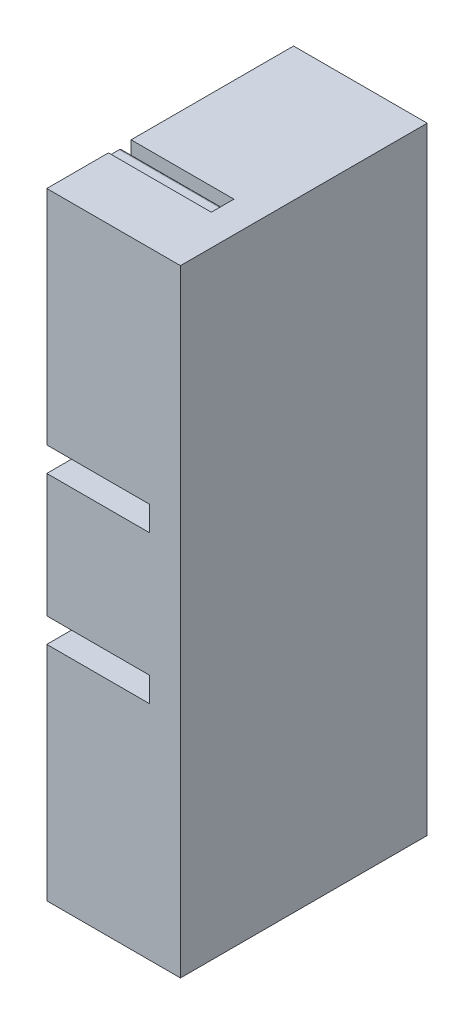
from build123d import *

# Parameters (mm, degrees)
SKETCH_1_W           = 150
SKETCH_1_H           = 140
EXTRUDE_1_DEPTH      = 3
EXTRUDE_2_DEPTH      = 14
EXTRUDE_2_DEPTH_BACK = 14
EXTRUDE_START        = 38
EXTRUDE_3_DEPTH      = 14
EXTRUDE_START_2      = 50.2
EXTRUDE_5_DEPTH      = 1.8
EXTRUDE_START_3      = 24
EXTRUDE_6_DEPTH      = 1.8
EXTRUDE_START_4      = 12.2
EXTRUDE_7_DEPTH      = 1.8
EXTRUDE_START_5      = -14
EXTRUDE_8_DEPTH      = 1.8
EXTRUDE_START_6      = -52
EXTRUDE_9_DEPTH      = 1.8
EXTRUDE_START_7      = -25.8
EXTRUDE_10_DEPTH     = 1.8
FILLET_1_R           = 1
CUT_EXTRUDE_5_REACH  = 105.412
SKETCH_5_W           = 1
SKETCH_5_H           = 4.5
CUT_EXTRUDE_6_REACH  = 105.078
SKETCH_3_9_R         = 1.7
CUT_EXTRUDE_7_DEPTH  = 10
EXTRUDE_START_8      = 3
SKETCH_3_12_W        = 10.254153824
SKETCH_3_12_H        = 16
EXTRUDE_11_DEPTH     = 3
CUT_EXTRUDE_START    = -15
SKETCH_6_W           = 2
SKETCH_6_H           = 4.5
CUT_EXTRUDE_8_DEPTH  = 20
CUT_EXTRUDE_START_2  = -115
SKETCH_6_3_W         = 2
SKETCH_6_3_H         = 4.5
CUT_EXTRUDE_9_DEPTH  = 20
CHAMFER_2_SIZE       = 2
FILLET_2_R           = 4
EXTRUDE_12_DEPTH     = 24
CUT_EXTRUDE_10_DEPTH = 10
SKETCH_8_W           = 8.2
SKETCH_8_H           = 2.4
CUT_EXTRUDE_11_DEPTH = 10
CHAMFER_1_SIZE       = 5
CHAMFER_1_SIZE2      = 10.2
CHAMFER_3_SIZE       = 5
CHAMFER_3_SIZE2      = 10.2
CUT_EXTRUDE_13_DEPTH = 132.034346642
SKETCH_10_R          = 1.7
EXTRUDE_13_DEPTH     = 3
EXTRUDE_14_DEPTH     = 3


with BuildPart() as part:
    # 草图1 → 凸台-拉伸1 (new body)
    with BuildSketch(Plane.XY):
        Rectangle(SKETCH_1_W, SKETCH_1_H)
    extrude(amount=EXTRUDE_1_DEPTH)

    # 草图2 → 凸台-拉伸2 (add, two sides: drawn at the far end of the back side and taken through both)
    with BuildSketch(Plane(origin=(0, 0, 0), x_dir=(1, 0, 0), z_dir=(0, 1, 0)).offset(-EXTRUDE_2_DEPTH_BACK)):
        with BuildLine():
            Line((56, -5), (56, -3))
            Line((56, -3), (44, -3))
            Line((44, -3), (44, -5))
            ThreePointArc((44, -5), (41.05572809, -8.527864045), (40, -13))
            Line((40, -13), (42.5, -13))
            ThreePointArc((42.5, -13), (50, -5.5), (57.5, -13))
            Line((57.5, -13), (60, -13))
            ThreePointArc((60, -13), (58.94427191, -8.527864045), (56, -5))
        make_face()
    extrude(amount=EXTRUDE_2_DEPTH + EXTRUDE_2_DEPTH_BACK)

    # 草图2<3> → 凸台-拉伸3 (add, symmetric)
    with BuildSketch(Plane(origin=(0, 0, 0), x_dir=(1, 0, 0), z_dir=(0, 1, 0)).offset(EXTRUDE_START)):
        with BuildLine():
            Line((-60, -13), (-57.5, -13))
            ThreePointArc((-57.5, -13), (-50, -5.5), (-42.5, -13))
            Line((-42.5, -13), (-40, -13))
            ThreePointArc((-40, -13), (-41.05572809, -8.527864045), (-44, -5))
            Line((-44, -5), (-44, -3))
            Line((-44, -3), (-56, -3))
            Line((-56, -3), (-56, -5))
            ThreePointArc((-56, -5), (-58.94427191, -8.527864045), (-60, -13))
        make_face()
    extrude_3 = extrude(amount=EXTRUDE_3_DEPTH, both=True)

    # 草图2<4> → 凸台-拉伸5 (add)
    with BuildSketch(Plane(origin=(0, 0, 0), x_dir=(1, 0, 0), z_dir=(0, 1, 0)).offset(EXTRUDE_START_2)):
        with BuildLine():
            Line((-55, -13), (-57.5, -13))
            ThreePointArc((-57.5, -13), (-50, -5.5), (-42.5, -13))
            Line((-42.5, -13), (-45, -13))
            ThreePointArc((-45, -13), (-50, -8), (-55, -13))
        make_face()
    extrude(amount=EXTRUDE_5_DEPTH)

    # 草图2<5> → 凸台-拉伸6 (add)
    with BuildSketch(Plane(origin=(0, 0, 0), x_dir=(1, 0, 0), z_dir=(0, 1, 0)).offset(EXTRUDE_START_3)):
        with BuildLine():
            Line((-55, -13), (-57.5, -13))
            ThreePointArc((-57.5, -13), (-50, -5.5), (-42.5, -13))
            Line((-42.5, -13), (-45, -13))
            ThreePointArc((-45, -13), (-50, -8), (-55, -13))
        make_face()
    extrude(amount=EXTRUDE_6_DEPTH)

    # 草图2<6> → 凸台-拉伸7 (add)
    with BuildSketch(Plane(origin=(0, 0, 0), x_dir=(1, 0, 0), z_dir=(0, 1, 0)).offset(EXTRUDE_START_4)):
        with BuildLine():
            Line((55, -13), (57.5, -13))
            ThreePointArc((57.5, -13), (50, -5.5), (42.5, -13))
            Line((42.5, -13), (45, -13))
            ThreePointArc((45, -13), (50, -8), (55, -13))
        make_face()
    extrude(amount=EXTRUDE_7_DEPTH)

    # 镜向5: 凸台-拉伸3 across plane
    add(extrude_3.mirror(Plane.ZX))

    # 草图2<7> → 凸台-拉伸8 (add)
    with BuildSketch(Plane(origin=(0, 0, 0), x_dir=(1, 0, 0), z_dir=(0, 1, 0)).offset(EXTRUDE_START_5)):
        with BuildLine():
            Line((55, -13), (57.5, -13))
            ThreePointArc((57.5, -13), (50, -5.5), (42.5, -13))
            Line((42.5, -13), (45, -13))
            ThreePointArc((45, -13), (50, -8), (55, -13))
        make_face()
    extrude(amount=EXTRUDE_8_DEPTH)

    # 草图2<8> → 凸台-拉伸9 (add)
    with BuildSketch(Plane(origin=(0, 0, 0), x_dir=(1, 0, 0), z_dir=(0, 1, 0)).offset(EXTRUDE_START_6)):
        with BuildLine():
            Line((-55, -13), (-57.5, -13))
            ThreePointArc((-57.5, -13), (-50, -5.5), (-42.5, -13))
            Line((-42.5, -13), (-45, -13))
            ThreePointArc((-45, -13), (-50, -8), (-55, -13))
        make_face()
    extrude(amount=EXTRUDE_9_DEPTH)

    # 草图2<9> → 凸台-拉伸10 (add)
    with BuildSketch(Plane(origin=(0, 0, 0), x_dir=(1, 0, 0), z_dir=(0, 1, 0)).offset(EXTRUDE_START_7)):
        with BuildLine():
            Line((-55, -13), (-57.5, -13))
            ThreePointArc((-57.5, -13), (-50, -5.5), (-42.5, -13))
            Line((-42.5, -13), (-45, -13))
            ThreePointArc((-45, -13), (-50, -8), (-55, -13))
        make_face()
    extrude(amount=EXTRUDE_10_DEPTH)

    # 圆角1
    fillet_1_edges = [part.edges().sort_by_distance(p)[0] for p in [
        (56, 0, 5),
        (44, 0, 5),
        (-44, 38, 5),
        (-56, 38, 5),
        (-56, -38, 5),
        (-44, -38, 5),
    ]]
    fillet(fillet_1_edges, radius=FILLET_1_R)

    # 草图5 → 切除-拉伸5 (cut, up to next)
    with BuildSketch(Plane.XY.offset(13), mode=Mode.PRIVATE) as cut_extrude_5_sk1:
        with Locations((59.5, 9.95)):
            Rectangle(SKETCH_5_W, SKETCH_5_H)
    cut_extrude_5_tool1 = extrude(cut_extrude_5_sk1.sketch, amount=-CUT_EXTRUDE_5_REACH, mode=Mode.PRIVATE) & part.part
    # 草图5 → 切除-拉伸5 (cut, up to next)
    with BuildSketch(Plane.XY.offset(13), mode=Mode.PRIVATE) as cut_extrude_5_sk2:
        with Locations((59.5, -9.95)):
            Rectangle(SKETCH_5_W, SKETCH_5_H)
    cut_extrude_5_tool2 = extrude(cut_extrude_5_sk2.sketch, amount=-CUT_EXTRUDE_5_REACH, mode=Mode.PRIVATE) & part.part
    # 草图5 → 切除-拉伸5 (cut, up to next)
    with BuildSketch(Plane.XY.offset(13), mode=Mode.PRIVATE) as cut_extrude_5_sk3:
        with Locations((-59.5, 47.95)):
            Rectangle(SKETCH_5_W, SKETCH_5_H)
    cut_extrude_5_tool3 = extrude(cut_extrude_5_sk3.sketch, amount=-CUT_EXTRUDE_5_REACH, mode=Mode.PRIVATE) & part.part
    # 草图5 → 切除-拉伸5 (cut, up to next)
    with BuildSketch(Plane.XY.offset(13), mode=Mode.PRIVATE) as cut_extrude_5_sk4:
        with Locations((-59.5, 28.05)):
            Rectangle(SKETCH_5_W, SKETCH_5_H)
    cut_extrude_5_tool4 = extrude(cut_extrude_5_sk4.sketch, amount=-CUT_EXTRUDE_5_REACH, mode=Mode.PRIVATE) & part.part
    # 草图5 → 切除-拉伸5 (cut, up to next)
    with BuildSketch(Plane.XY.offset(13), mode=Mode.PRIVATE) as cut_extrude_5_sk5:
        with Locations((-59.5, -28.05)):
            Rectangle(SKETCH_5_W, SKETCH_5_H)
    cut_extrude_5_tool5 = extrude(cut_extrude_5_sk5.sketch, amount=-CUT_EXTRUDE_5_REACH, mode=Mode.PRIVATE) & part.part
    # 草图5 → 切除-拉伸5 (cut, up to next)
    with BuildSketch(Plane.XY.offset(13), mode=Mode.PRIVATE) as cut_extrude_5_sk6:
        with Locations((-59.5, -47.95)):
            Rectangle(SKETCH_5_W, SKETCH_5_H)
    cut_extrude_5_tool6 = extrude(cut_extrude_5_sk6.sketch, amount=-CUT_EXTRUDE_5_REACH, mode=Mode.PRIVATE) & part.part
    # 草图5 → 切除-拉伸5 (cut, up to next)
    with BuildSketch(Plane.XY.offset(13), mode=Mode.PRIVATE) as cut_extrude_5_sk7:
        with Locations((-40.5, -47.95)):
            Rectangle(SKETCH_5_W, SKETCH_5_H)
    cut_extrude_5_tool7 = extrude(cut_extrude_5_sk7.sketch, amount=-CUT_EXTRUDE_5_REACH, mode=Mode.PRIVATE) & part.part
    # 草图5 → 切除-拉伸5 (cut, up to next)
    with BuildSketch(Plane.XY.offset(13), mode=Mode.PRIVATE) as cut_extrude_5_sk8:
        with Locations((-40.5, -28.05)):
            Rectangle(SKETCH_5_W, SKETCH_5_H)
    cut_extrude_5_tool8 = extrude(cut_extrude_5_sk8.sketch, amount=-CUT_EXTRUDE_5_REACH, mode=Mode.PRIVATE) & part.part
    # 草图5 → 切除-拉伸5 (cut, up to next)
    with BuildSketch(Plane.XY.offset(13), mode=Mode.PRIVATE) as cut_extrude_5_sk9:
        with Locations((-40.5, 28.05)):
            Rectangle(SKETCH_5_W, SKETCH_5_H)
    cut_extrude_5_tool9 = extrude(cut_extrude_5_sk9.sketch, amount=-CUT_EXTRUDE_5_REACH, mode=Mode.PRIVATE) & part.part
    # 草图5 → 切除-拉伸5 (cut, up to next)
    with BuildSketch(Plane.XY.offset(13), mode=Mode.PRIVATE) as cut_extrude_5_sk10:
        with Locations((-40.5, 47.95)):
            Rectangle(SKETCH_5_W, SKETCH_5_H)
    cut_extrude_5_tool10 = extrude(cut_extrude_5_sk10.sketch, amount=-CUT_EXTRUDE_5_REACH, mode=Mode.PRIVATE) & part.part
    # 草图5 → 切除-拉伸5 (cut, up to next)
    with BuildSketch(Plane.XY.offset(13), mode=Mode.PRIVATE) as cut_extrude_5_sk11:
        with Locations((40.5, -9.95)):
            Rectangle(SKETCH_5_W, SKETCH_5_H)
    cut_extrude_5_tool11 = extrude(cut_extrude_5_sk11.sketch, amount=-CUT_EXTRUDE_5_REACH, mode=Mode.PRIVATE) & part.part
    # 草图5 → 切除-拉伸5 (cut, up to next)
    with BuildSketch(Plane.XY.offset(13), mode=Mode.PRIVATE) as cut_extrude_5_sk12:
        with Locations((40.5, 9.95)):
            Rectangle(SKETCH_5_W, SKETCH_5_H)
    cut_extrude_5_tool12 = extrude(cut_extrude_5_sk12.sketch, amount=-CUT_EXTRUDE_5_REACH, mode=Mode.PRIVATE) & part.part
    add(cut_extrude_5_tool1.solids().sort_by_distance((59.5, 9.95, 13))[0], mode=Mode.SUBTRACT)
    add(cut_extrude_5_tool2.solids().sort_by_distance((59.5, -9.95, 13))[0], mode=Mode.SUBTRACT)
    add(cut_extrude_5_tool3.solids().sort_by_distance((-59.5, 47.95, 13))[0], mode=Mode.SUBTRACT)
    add(cut_extrude_5_tool4.solids().sort_by_distance((-59.5, 28.05, 13))[0], mode=Mode.SUBTRACT)
    add(cut_extrude_5_tool5.solids().sort_by_distance((-59.5, -28.05, 13))[0], mode=Mode.SUBTRACT)
    add(cut_extrude_5_tool6.solids().sort_by_distance((-59.5, -47.95, 13))[0], mode=Mode.SUBTRACT)
    add(cut_extrude_5_tool7.solids().sort_by_distance((-40.5, -47.95, 13))[0], mode=Mode.SUBTRACT)
    add(cut_extrude_5_tool8.solids().sort_by_distance((-40.5, -28.05, 13))[0], mode=Mode.SUBTRACT)
    add(cut_extrude_5_tool9.solids().sort_by_distance((-40.5, 28.05, 13))[0], mode=Mode.SUBTRACT)
    add(cut_extrude_5_tool10.solids().sort_by_distance((-40.5, 47.95, 13))[0], mode=Mode.SUBTRACT)
    add(cut_extrude_5_tool11.solids().sort_by_distance((40.5, -9.95, 13))[0], mode=Mode.SUBTRACT)
    add(cut_extrude_5_tool12.solids().sort_by_distance((40.5, 9.95, 13))[0], mode=Mode.SUBTRACT)

    # 草图3 → 切除-拉伸6 (cut, up to next)
    with BuildSketch(Plane.XY.offset(3), mode=Mode.PRIVATE) as cut_extrude_6_sk1:
        with BuildLine():
            Line((-56, 46), (-56, 52))
            Line((-56, 52), (-44, 52))
            Line((-44, 52), (-44, 18))
            Line((-44, 18), (-34, 8))
            Line((-34, 8), (13.5, 8))
            Line((13.5, 8), (13.5, 30))
            Line((13.5, 30), (26.5, 30))
            Line((26.5, 30), (26.5, 8))
            Line((26.5, 8), (44, 8))
            Line((44, 8), (44, 14))
            Line((44, 14), (56, 14))
            Line((56, 14), (56, 8))
            Line((56, 8), (71, 8))
            ThreePointArc((71, 8), (73.828427125, 6.828427125), (75, 4))
            Line((75, 4), (75, 70))
            Line((75, 70), (-75, 70))
            Line((-75, 70), (-75, 42))
            ThreePointArc((-75, 42), (-73.828427125, 44.828427125), (-71, 46))
            Line((-71, 46), (-56, 46))
        make_face()
    cut_extrude_6_tool1 = extrude(cut_extrude_6_sk1.sketch, amount=-CUT_EXTRUDE_6_REACH, mode=Mode.PRIVATE) & part.part
    # 草图3 → 切除-拉伸6 (cut, up to next)
    with BuildSketch(Plane.XY.offset(3), mode=Mode.PRIVATE) as cut_extrude_6_sk2:
        with BuildLine():
            Line((-56, -30), (-56, 30))
            Line((-56, 30), (-71, 30))
            ThreePointArc((-71, 30), (-73.828427125, 31.171572875), (-75, 34))
            Line((-75, 34), (-75, -34))
            ThreePointArc((-75, -34), (-73.828427125, -31.171572875), (-71, -30))
            Line((-71, -30), (-56, -30))
        make_face()
    cut_extrude_6_tool2 = extrude(cut_extrude_6_sk2.sketch, amount=-CUT_EXTRUDE_6_REACH, mode=Mode.PRIVATE) & part.part
    # 草图3 → 切除-拉伸6 (cut, up to next)
    with BuildSketch(Plane.XY.offset(3), mode=Mode.PRIVATE) as cut_extrude_6_sk3:
        with BuildLine():
            Line((-44, -18), (-44, -52))
            Line((-44, -52), (-56, -52))
            Line((-56, -52), (-56, -46))
            Line((-56, -46), (-71, -46))
            ThreePointArc((-71, -46), (-73.828427125, -44.828427125), (-75, -42))
            Line((-75, -42), (-75, -70))
            Line((-75, -70), (75, -70))
            Line((75, -70), (75, -4))
            ThreePointArc((75, -4), (73.828427125, -6.828427125), (71, -8))
            Line((71, -8), (56, -8))
            Line((56, -8), (56, -14))
            Line((56, -14), (44, -14))
            Line((44, -14), (44, -8))
            Line((44, -8), (26.5, -8))
            Line((26.5, -8), (26.5, -30))
            Line((26.5, -30), (13.5, -30))
            Line((13.5, -30), (13.5, -8))
            Line((13.5, -8), (-34, -8))
            Line((-34, -8), (-44, -18))
        make_face()
    cut_extrude_6_tool3 = extrude(cut_extrude_6_sk3.sketch, amount=-CUT_EXTRUDE_6_REACH, mode=Mode.PRIVATE) & part.part
    add(cut_extrude_6_tool1.solids().sort_by_distance((8.681591, 41.934656, 3))[0], mode=Mode.SUBTRACT)
    add(cut_extrude_6_tool2.solids().sort_by_distance((-65.551535, 0, 3))[0], mode=Mode.SUBTRACT)
    add(cut_extrude_6_tool3.solids().sort_by_distance((8.681591, -41.934656, 3))[0], mode=Mode.SUBTRACT)

    # 草图3<9> → 切除-拉伸7 (cut)
    with BuildSketch(Plane.XY.offset(3)):
        with Locations((-69, 38)):
            Circle(SKETCH_3_9_R)
        with Locations((-69, -38)):
            Circle(SKETCH_3_9_R)
        with Locations((69, 0)):
            Circle(SKETCH_3_9_R)
        with Locations((8.5, -4.5)):
            Circle(SKETCH_3_9_R)
        with Locations((8.5, 4.5)):
            Circle(SKETCH_3_9_R)
    extrude(amount=-CUT_EXTRUDE_7_DEPTH, mode=Mode.SUBTRACT)

    # 草图3<12> → 凸台-拉伸11 (add)
    # profile 1 of 4: a face of its own
    with BuildSketch(Plane.XY.offset(3).offset(EXTRUDE_START_8)):
        with BuildLine():
            Line((64, 8), (64, -8))
            Line((64, -8), (71, -8))
            ThreePointArc((71, -8), (73.828427125, -6.828427125), (75, -4))
            Line((75, -4), (75, 4))
            ThreePointArc((75, 4), (73.828427125, 6.828427125), (71, 8))
            Line((71, 8), (64, 8))
        make_face()
        Polygon((70.645448267, 2.85), (72.290896534, 0), (70.645448267, -2.85), (67.354551733, -2.85), (65.709103466, 0), (67.354551733, 2.85), align=None, mode=Mode.SUBTRACT)
    # profile 2 of 4: a face of its own
    with BuildSketch(Plane.XY.offset(3).offset(EXTRUDE_START_8)):
        with BuildLine():
            Line((-64, 30), (-64, 46))
            Line((-64, 46), (-71, 46))
            ThreePointArc((-71, 46), (-73.828427125, 44.828427125), (-75, 42))
            Line((-75, 42), (-75, 34))
            ThreePointArc((-75, 34), (-73.828427125, 31.171572875), (-71, 30))
            Line((-71, 30), (-64, 30))
        make_face()
        Polygon((-67.354551733, 40.85), (-65.709103466, 38), (-67.354551733, 35.15), (-70.645448267, 35.15), (-72.290896534, 38), (-70.645448267, 40.85), align=None, mode=Mode.SUBTRACT)
    # profile 3 of 4: a face of its own
    with BuildSketch(Plane.XY.offset(3).offset(EXTRUDE_START_8)):
        with Locations((8.372923088, 0)):
            Rectangle(SKETCH_3_12_W, SKETCH_3_12_H)
        Polygon((10.145448267, -1.65), (11.790896534, -4.5), (10.145448267, -7.35), (6.854551733, -7.35), (5.209103466, -4.5), (6.854551733, -1.65), align=None, mode=Mode.SUBTRACT)
        Polygon((6.854551733, 7.35), (10.145448267, 7.35), (11.790896534, 4.5), (10.145448267, 1.65), (6.854551733, 1.65), (5.209103466, 4.5), align=None, mode=Mode.SUBTRACT)
    # profile 4 of 4: a face of its own
    with BuildSketch(Plane.XY.offset(3).offset(EXTRUDE_START_8)):
        with BuildLine():
            Line((-64, -46), (-64, -30))
            Line((-64, -30), (-71, -30))
            ThreePointArc((-71, -30), (-73.828427125, -31.171572875), (-75, -34))
            Line((-75, -34), (-75, -42))
            ThreePointArc((-75, -42), (-73.828427125, -44.828427125), (-71, -46))
            Line((-71, -46), (-64, -46))
        make_face()
        Polygon((-70.645448267, -35.15), (-67.354551733, -35.15), (-65.709103466, -38), (-67.354551733, -40.85), (-70.645448267, -40.85), (-72.290896534, -38), align=None, mode=Mode.SUBTRACT)
    extrude(amount=-EXTRUDE_11_DEPTH)

    # 草图6 → 切除-拉伸8 (cut)
    with BuildSketch(Plane(origin=(75, 0, 0), x_dir=(0, 0, -1), z_dir=(1, 0, 0)).offset(CUT_EXTRUDE_START)):
        with Locations((-4, 9.95)):
            Rectangle(SKETCH_6_W, SKETCH_6_H)
        with Locations((-4, -9.95)):
            Rectangle(SKETCH_6_W, SKETCH_6_H)
    extrude(amount=-CUT_EXTRUDE_8_DEPTH, mode=Mode.SUBTRACT)

    # 草图6<3> → 切除-拉伸9 (cut)
    with BuildSketch(Plane(origin=(75, 0, 0), x_dir=(0, 0, -1), z_dir=(1, 0, 0)).offset(CUT_EXTRUDE_START_2)):
        with Locations((-4, 47.95)):
            Rectangle(SKETCH_6_3_W, SKETCH_6_3_H)
        with Locations((-4, 28.05)):
            Rectangle(SKETCH_6_3_W, SKETCH_6_3_H)
        with Locations((-4, -28.05)):
            Rectangle(SKETCH_6_3_W, SKETCH_6_3_H)
        with Locations((-4, -47.95)):
            Rectangle(SKETCH_6_3_W, SKETCH_6_3_H)
    extrude(amount=-CUT_EXTRUDE_9_DEPTH, mode=Mode.SUBTRACT)

    # 倒角2
    chamfer_2_edges = [part.edges().sort_by_distance(p)[0] for p in [
        (44, 8, 1.5),
        (26.5, 8, 1.5),
        (26.5, -8, 1.5),
        (44, -8, 1.5),
    ]]
    chamfer(chamfer_2_edges, length=CHAMFER_2_SIZE)

    # 圆角2
    # the kernel refuses this fillet: 4 mm, written as the material it takes off along each edge
    with BuildSketch(Plane(origin=(56.125641957, 7.7, 5), x_dir=(0.7056664326282083, 0, 0.7085442017699237), z_dir=(0, 1, 0)), Plane(origin=(43.874358043, 12.2, 5), x_dir=(-0.7056664326282107, 0, 0.7085442017699214), z_dir=(0, -1, 0)), Plane(origin=(56.125641957, -12.2, 5), x_dir=(0.7056664326282083, 0, 0.7085442017699237), z_dir=(0, 1, 0)), Plane(origin=(43.874358043, -7.7, 5), x_dir=(-0.7056664326282107, 0, 0.7085442017699214), z_dir=(0, -1, 0)), Plane(origin=(-56.125641957, -25.8, 5), x_dir=(-0.7056664326282412, 0, 0.7085442017698909), z_dir=(0, -1, 0)), Plane(origin=(-43.874358043, -30.3, 5), x_dir=(0.7056664326282412, 0, 0.7085442017698909), z_dir=(0, 1, 0)), Plane(origin=(-56.125641957, -45.7, 5), x_dir=(-0.7056664326282412, 0, 0.7085442017698909), z_dir=(0, -1, 0)), Plane(origin=(-43.874358043, -50.2, 5), x_dir=(0.7056664326282412, 0, 0.7085442017698909), z_dir=(0, 1, 0))) as fillet_2_piece_1:
        with BuildLine():
            CenterArc((1.667353126, -3.994247821), FILLET_2_R, 86.926905589, 48.189685104)
            Line((-1.166823682, -1.17158209), (-1.450241362, -0.889315517))
            Line((-1.450241362, -0.889315517), (-0.283417681, 0.282266573))
            Line((-0.283417681, 0.282266573), (0.109264727, 0.384787239))
            ThreePointArc((0.109264727, 0.384787239), (0.331663557, 0.364826953), (1.903236699, 0.399424782))
            Line((1.903236699, 0.399424782), (1.881792738, 0))
        make_face()
    extrude(amount=4.5, mode=Mode.SUBTRACT)
    with BuildSketch(Plane(origin=(-43.874358043, 50.2, 5), x_dir=(0.7056664326282412, 0, 0.7085442017698909), z_dir=(0, -1, 0)), Plane(origin=(-56.125641957, 45.7, 5), x_dir=(-0.7056664326282412, 0, 0.7085442017698909), z_dir=(0, 1, 0)), Plane(origin=(-43.874358043, 30.3, 5), x_dir=(0.7056664326282412, 0, 0.7085442017698909), z_dir=(0, -1, 0)), Plane(origin=(-56.125641957, 25.8, 5), x_dir=(-0.7056664326282412, 0, 0.7085442017698909), z_dir=(0, 1, 0))) as fillet_2_piece_2:
        with BuildLine():
            CenterArc((1.667353126, 3.994247821), FILLET_2_R, 224.883409306, 48.189685104)
            Line((-1.166823682, 1.17158209), (-1.450241362, 0.889315517))
            Line((-1.450241362, 0.889315517), (-0.283417681, -0.282266573))
            Line((-0.283417681, -0.282266573), (0.109264727, -0.384787239))
            ThreePointArc((0.109264727, -0.384787239), (0.331663557, -0.364826953), (1.903236699, -0.399424782))
            Line((1.903236699, -0.399424782), (1.881792738, 0))
        make_face()
    extrude(amount=4.5, mode=Mode.SUBTRACT)

    # 草图3<13> → 凸台-拉伸12 (add)
    with BuildSketch(Plane.XY.offset(3)):
        Polygon((26.5, 8), (26.5, -8), (26.5, -30), (13.5, -30), (13.5, -8), (13.5, 8), (13.5, 30), (26.5, 30), align=None)
    extrude(amount=EXTRUDE_12_DEPTH)

    # 草图7 → 切除-拉伸10 (cut)
    with BuildSketch(Plane.ZY.offset(-13.5)):
        with BuildLine():
            Line((21, -6.01), (21, -6))
            Line((21, -6), (18.8, -6))
            Line((18.8, -6), (18.8, -30))
            Line((18.8, -30), (21, -30))
            Line((21, -30), (21, -29.31))
            ThreePointArc((21, -29.31), (20.926776695, -29.133223305), (20.75, -29.06))
            Line((20.75, -29.06), (19.95, -29.06))
            ThreePointArc((19.95, -29.06), (19.773223305, -28.986776695), (19.7, -28.81))
            Line((19.7, -28.81), (19.7, -28.51))
            ThreePointArc((19.7, -28.51), (19.773223305, -28.333223305), (19.95, -28.26))
            Line((19.95, -28.26), (20.75, -28.26))
            ThreePointArc((20.75, -28.26), (20.926776695, -28.186776695), (21, -28.01))
            Line((21, -28.01), (21, -27.31))
            ThreePointArc((21, -27.31), (20.926776695, -27.133223305), (20.75, -27.06))
            Line((20.75, -27.06), (19.95, -27.06))
            ThreePointArc((19.95, -27.06), (19.773223305, -26.986776695), (19.7, -26.81))
            Line((19.7, -26.81), (19.7, -26.51))
            ThreePointArc((19.7, -26.51), (19.773223305, -26.333223305), (19.95, -26.26))
            Line((19.95, -26.26), (20.75, -26.26))
            ThreePointArc((20.75, -26.26), (20.926776695, -26.186776695), (21, -26.01))
            Line((21, -26.01), (21, -25.31))
            ThreePointArc((21, -25.31), (20.926776695, -25.133223305), (20.75, -25.06))
            Line((20.75, -25.06), (19.95, -25.06))
            ThreePointArc((19.95, -25.06), (19.773223305, -24.986776695), (19.7, -24.81))
            Line((19.7, -24.81), (19.7, -24.51))
            ThreePointArc((19.7, -24.51), (19.773223305, -24.333223305), (19.95, -24.26))
            Line((19.95, -24.26), (20.75, -24.26))
            ThreePointArc((20.75, -24.26), (20.926776695, -24.186776695), (21, -24.01))
            Line((21, -24.01), (21, -23.31))
            ThreePointArc((21, -23.31), (20.926776695, -23.133223305), (20.75, -23.06))
            Line((20.75, -23.06), (19.95, -23.06))
            ThreePointArc((19.95, -23.06), (19.773223305, -22.986776695), (19.7, -22.81))
            Line((19.7, -22.81), (19.7, -22.51))
            ThreePointArc((19.7, -22.51), (19.773223305, -22.333223305), (19.95, -22.26))
            Line((19.95, -22.26), (20.75, -22.26))
            ThreePointArc((20.75, -22.26), (20.926776695, -22.186776695), (21, -22.01))
            Line((21, -22.01), (21, -21.31))
            ThreePointArc((21, -21.31), (20.926776695, -21.133223305), (20.75, -21.06))
            Line((20.75, -21.06), (19.95, -21.06))
            ThreePointArc((19.95, -21.06), (19.773223305, -20.986776695), (19.7, -20.81))
            Line((19.7, -20.81), (19.7, -20.51))
            ThreePointArc((19.7, -20.51), (19.773223305, -20.333223305), (19.95, -20.26))
            Line((19.95, -20.26), (20.75, -20.26))
            ThreePointArc((20.75, -20.26), (20.926776695, -20.186776695), (21, -20.01))
            Line((21, -20.01), (21, -19.31))
            ThreePointArc((21, -19.31), (20.926776695, -19.133223305), (20.75, -19.06))
            Line((20.75, -19.06), (19.95, -19.06))
            ThreePointArc((19.95, -19.06), (19.773223305, -18.986776695), (19.7, -18.81))
            Line((19.7, -18.81), (19.7, -18.51))
            ThreePointArc((19.7, -18.51), (19.773223305, -18.333223305), (19.95, -18.26))
            Line((19.95, -18.26), (20.75, -18.26))
            ThreePointArc((20.75, -18.26), (20.926776695, -18.186776695), (21, -18.01))
            Line((21, -18.01), (21, -17.31))
            ThreePointArc((21, -17.31), (20.926776695, -17.133223305), (20.75, -17.06))
            Line((20.75, -17.06), (19.95, -17.06))
            ThreePointArc((19.95, -17.06), (19.773223305, -16.986776695), (19.7, -16.81))
            Line((19.7, -16.81), (19.7, -16.51))
            ThreePointArc((19.7, -16.51), (19.773223305, -16.333223305), (19.95, -16.26))
            Line((19.95, -16.26), (20.75, -16.26))
            ThreePointArc((20.75, -16.26), (20.926776695, -16.186776695), (21, -16.01))
            Line((21, -16.01), (21, -15.31))
            ThreePointArc((21, -15.31), (20.926776695, -15.133223305), (20.75, -15.06))
            Line((20.75, -15.06), (19.95, -15.06))
            ThreePointArc((19.95, -15.06), (19.773223305, -14.986776695), (19.7, -14.81))
            Line((19.7, -14.81), (19.7, -14.51))
            ThreePointArc((19.7, -14.51), (19.773223305, -14.333223305), (19.95, -14.26))
            Line((19.95, -14.26), (20.75, -14.26))
            ThreePointArc((20.75, -14.26), (20.926776695, -14.186776695), (21, -14.01))
            Line((21, -14.01), (21, -13.31))
            ThreePointArc((21, -13.31), (20.926776695, -13.133223305), (20.75, -13.06))
            Line((20.75, -13.06), (19.95, -13.06))
            ThreePointArc((19.95, -13.06), (19.773223305, -12.986776695), (19.7, -12.81))
            Line((19.7, -12.81), (19.7, -12.51))
            ThreePointArc((19.7, -12.51), (19.773223305, -12.333223305), (19.95, -12.26))
            Line((19.95, -12.26), (20.75, -12.26))
            ThreePointArc((20.75, -12.26), (20.926776695, -12.186776695), (21, -12.01))
            Line((21, -12.01), (21, -11.31))
            ThreePointArc((21, -11.31), (20.926776695, -11.133223305), (20.75, -11.06))
            Line((20.75, -11.06), (19.95, -11.06))
            ThreePointArc((19.95, -11.06), (19.773223305, -10.986776695), (19.7, -10.81))
            Line((19.7, -10.81), (19.7, -10.51))
            ThreePointArc((19.7, -10.51), (19.773223305, -10.333223305), (19.95, -10.26))
            Line((19.95, -10.26), (20.75, -10.26))
            ThreePointArc((20.75, -10.26), (20.926776695, -10.186776695), (21, -10.01))
            Line((21, -10.01), (21, -9.31))
            ThreePointArc((21, -9.31), (20.926776695, -9.133223305), (20.75, -9.06))
            Line((20.75, -9.06), (19.95, -9.06))
            ThreePointArc((19.95, -9.06), (19.773223305, -8.986776695), (19.7, -8.81))
            Line((19.7, -8.81), (19.7, -8.51))
            ThreePointArc((19.7, -8.51), (19.773223305, -8.333223305), (19.95, -8.26))
            Line((19.95, -8.26), (20.75, -8.26))
            ThreePointArc((20.75, -8.26), (20.926776695, -8.186776695), (21, -8.01))
            Line((21, -8.01), (21, -7.31))
            ThreePointArc((21, -7.31), (20.926776695, -7.133223305), (20.75, -7.06))
            Line((20.75, -7.06), (19.95, -7.06))
            ThreePointArc((19.95, -7.06), (19.773223305, -6.986776695), (19.7, -6.81))
            Line((19.7, -6.81), (19.7, -6.51))
            ThreePointArc((19.7, -6.51), (19.773223305, -6.333223305), (19.95, -6.26))
            Line((19.95, -6.26), (20.75, -6.26))
            ThreePointArc((20.75, -6.26), (20.926776695, -6.186776695), (21, -6.01))
        make_face()
        with BuildLine():
            Line((18.8, 30), (18.8, 6))
            Line((18.8, 6), (21, 6))
            Line((21, 6), (21, 6.69))
            ThreePointArc((21, 6.69), (20.926776695, 6.866776695), (20.75, 6.94))
            Line((20.75, 6.94), (19.95, 6.94))
            ThreePointArc((19.95, 6.94), (19.773223305, 7.013223305), (19.7, 7.19))
            Line((19.7, 7.19), (19.7, 7.49))
            ThreePointArc((19.7, 7.49), (19.773223305, 7.666776695), (19.95, 7.74))
            Line((19.95, 7.74), (20.75, 7.74))
            ThreePointArc((20.75, 7.74), (20.926776695, 7.813223305), (21, 7.99))
            Line((21, 7.99), (21, 8.69))
            ThreePointArc((21, 8.69), (20.926776695, 8.866776695), (20.75, 8.94))
            Line((20.75, 8.94), (19.95, 8.94))
            ThreePointArc((19.95, 8.94), (19.773223305, 9.013223305), (19.7, 9.19))
            Line((19.7, 9.19), (19.7, 9.49))
            ThreePointArc((19.7, 9.49), (19.773223305, 9.666776695), (19.95, 9.74))
            Line((19.95, 9.74), (20.75, 9.74))
            ThreePointArc((20.75, 9.74), (20.926776695, 9.813223305), (21, 9.99))
            Line((21, 9.99), (21, 10.69))
            ThreePointArc((21, 10.69), (20.926776695, 10.866776695), (20.75, 10.94))
            Line((20.75, 10.94), (19.95, 10.94))
            ThreePointArc((19.95, 10.94), (19.773223305, 11.013223305), (19.7, 11.19))
            Line((19.7, 11.19), (19.7, 11.49))
            ThreePointArc((19.7, 11.49), (19.773223305, 11.666776695), (19.95, 11.74))
            Line((19.95, 11.74), (20.75, 11.74))
            ThreePointArc((20.75, 11.74), (20.926776695, 11.813223305), (21, 11.99))
            Line((21, 11.99), (21, 12.69))
            ThreePointArc((21, 12.69), (20.926776695, 12.866776695), (20.75, 12.94))
            Line((20.75, 12.94), (19.95, 12.94))
            ThreePointArc((19.95, 12.94), (19.773223305, 13.013223305), (19.7, 13.19))
            Line((19.7, 13.19), (19.7, 13.49))
            ThreePointArc((19.7, 13.49), (19.773223305, 13.666776695), (19.95, 13.74))
            Line((19.95, 13.74), (20.75, 13.74))
            ThreePointArc((20.75, 13.74), (20.926776695, 13.813223305), (21, 13.99))
            Line((21, 13.99), (21, 14.69))
            ThreePointArc((21, 14.69), (20.926776695, 14.866776695), (20.75, 14.94))
            Line((20.75, 14.94), (19.95, 14.94))
            ThreePointArc((19.95, 14.94), (19.773223305, 15.013223305), (19.7, 15.19))
            Line((19.7, 15.19), (19.7, 15.49))
            ThreePointArc((19.7, 15.49), (19.773223305, 15.666776695), (19.95, 15.74))
            Line((19.95, 15.74), (20.75, 15.74))
            ThreePointArc((20.75, 15.74), (20.926776695, 15.813223305), (21, 15.99))
            Line((21, 15.99), (21, 16.69))
            ThreePointArc((21, 16.69), (20.926776695, 16.866776695), (20.75, 16.94))
            Line((20.75, 16.94), (19.95, 16.94))
            ThreePointArc((19.95, 16.94), (19.773223305, 17.013223305), (19.7, 17.19))
            Line((19.7, 17.19), (19.7, 17.49))
            ThreePointArc((19.7, 17.49), (19.773223305, 17.666776695), (19.95, 17.74))
            Line((19.95, 17.74), (20.75, 17.74))
            ThreePointArc((20.75, 17.74), (20.926776695, 17.813223305), (21, 17.99))
            Line((21, 17.99), (21, 18.69))
            ThreePointArc((21, 18.69), (20.926776695, 18.866776695), (20.75, 18.94))
            Line((20.75, 18.94), (19.95, 18.94))
            ThreePointArc((19.95, 18.94), (19.773223305, 19.013223305), (19.7, 19.19))
            Line((19.7, 19.19), (19.7, 19.49))
            ThreePointArc((19.7, 19.49), (19.773223305, 19.666776695), (19.95, 19.74))
            Line((19.95, 19.74), (20.75, 19.74))
            ThreePointArc((20.75, 19.74), (20.926776695, 19.813223305), (21, 19.99))
            Line((21, 19.99), (21, 20.69))
            ThreePointArc((21, 20.69), (20.926776695, 20.866776695), (20.75, 20.94))
            Line((20.75, 20.94), (19.95, 20.94))
            ThreePointArc((19.95, 20.94), (19.773223305, 21.013223305), (19.7, 21.19))
            Line((19.7, 21.19), (19.7, 21.49))
            ThreePointArc((19.7, 21.49), (19.773223305, 21.666776695), (19.95, 21.74))
            Line((19.95, 21.74), (20.75, 21.74))
            ThreePointArc((20.75, 21.74), (20.926776695, 21.813223305), (21, 21.99))
            Line((21, 21.99), (21, 22.69))
            ThreePointArc((21, 22.69), (20.926776695, 22.866776695), (20.75, 22.94))
            Line((20.75, 22.94), (19.95, 22.94))
            ThreePointArc((19.95, 22.94), (19.773223305, 23.013223305), (19.7, 23.19))
            Line((19.7, 23.19), (19.7, 23.49))
            ThreePointArc((19.7, 23.49), (19.773223305, 23.666776695), (19.95, 23.74))
            Line((19.95, 23.74), (20.75, 23.74))
            ThreePointArc((20.75, 23.74), (20.926776695, 23.813223305), (21, 23.99))
            Line((21, 23.99), (21, 24.69))
            ThreePointArc((21, 24.69), (20.926776695, 24.866776695), (20.75, 24.94))
            Line((20.75, 24.94), (19.95, 24.94))
            ThreePointArc((19.95, 24.94), (19.773223305, 25.013223305), (19.7, 25.19))
            Line((19.7, 25.19), (19.7, 25.49))
            ThreePointArc((19.7, 25.49), (19.773223305, 25.666776695), (19.95, 25.74))
            Line((19.95, 25.74), (20.75, 25.74))
            ThreePointArc((20.75, 25.74), (20.926776695, 25.813223305), (21, 25.99))
            Line((21, 25.99), (21, 26.69))
            ThreePointArc((21, 26.69), (20.926776695, 26.866776695), (20.75, 26.94))
            Line((20.75, 26.94), (19.95, 26.94))
            ThreePointArc((19.95, 26.94), (19.773223305, 27.013223305), (19.7, 27.19))
            Line((19.7, 27.19), (19.7, 27.49))
            ThreePointArc((19.7, 27.49), (19.773223305, 27.666776695), (19.95, 27.74))
            Line((19.95, 27.74), (20.75, 27.74))
            ThreePointArc((20.75, 27.74), (20.926776695, 27.813223305), (21, 27.99))
            Line((21, 27.99), (21, 28.69))
            ThreePointArc((21, 28.69), (20.926776695, 28.866776695), (20.75, 28.94))
            Line((20.75, 28.94), (19.95, 28.94))
            ThreePointArc((19.95, 28.94), (19.773223305, 29.013223305), (19.7, 29.19))
            Line((19.7, 29.19), (19.7, 29.49))
            ThreePointArc((19.7, 29.49), (19.773223305, 29.666776695), (19.95, 29.74))
            Line((19.95, 29.74), (20.75, 29.74))
            ThreePointArc((20.75, 29.74), (20.926776695, 29.813223305), (21, 29.99))
            Line((21, 29.99), (21, 30))
            Line((21, 30), (18.8, 30))
        make_face()
    extrude(amount=-CUT_EXTRUDE_10_DEPTH, mode=Mode.SUBTRACT)

    # 草图8 → 切除-拉伸11 (cut)
    with BuildSketch(Plane.ZY.offset(-13.5)):
        with Locations((22.9, 7.2)):
            Rectangle(SKETCH_8_W, SKETCH_8_H)
        with Locations((22.9, -7.2)):
            Rectangle(SKETCH_8_W, SKETCH_8_H)
    extrude(amount=-CUT_EXTRUDE_11_DEPTH, mode=Mode.SUBTRACT)

    # 倒角1
    chamfer_1_edges = [part.edges().sort_by_distance(p)[0] for p in [
        (13.5, 8, 3),
    ]]
    chamfer_1_side = [part.faces().sort_by_distance(p)[0] for p in [
        (13.5, 0, 11.118683652),
    ]]
    chamfer(chamfer_1_edges, length=CHAMFER_1_SIZE, length2=CHAMFER_1_SIZE2, reference=chamfer_1_side[0])

    # 倒角3
    chamfer_3_edges = [part.edges().sort_by_distance(p)[0] for p in [
        (13.5, -8, 3),
    ]]
    chamfer_3_side = [part.faces().sort_by_distance(p)[0] for p in [
        (13.5, -0.286259542, 11.34002181),
    ]]
    chamfer(chamfer_3_edges, length=CHAMFER_3_SIZE, length2=CHAMFER_3_SIZE2, reference=chamfer_3_side[0])

    # 草图9 → 切除-拉伸13 (cut, through all)
    with BuildSketch(Plane.XZ.offset(52)):
        Polygon((-75, 0), (75, 0), (75, 13), (40, 13), (40, 3), (-40, 3), (-40, 13), (-75, 13), align=None)
    extrude(amount=-CUT_EXTRUDE_13_DEPTH, mode=Mode.SUBTRACT)

    # 草图10 → 凸台-拉伸13 (add)
    # profile 1 of 2: a face of its own
    with BuildSketch(Plane.XY.offset(6)):
        Polygon((10.145448267, 7.35), (11.790896534, 4.5), (10.145448267, 1.65), (6.854551733, 1.65), (5.209103466, 4.5), (6.854551733, 7.35), align=None)
        with Locations((8.5, 4.5)):
            Circle(SKETCH_10_R, mode=Mode.SUBTRACT)
    # profile 2 of 2: a face of its own
    with BuildSketch(Plane.XY.offset(6)):
        Polygon((11.790896534, -4.5), (10.145448267, -7.35), (6.854551733, -7.35), (5.209103466, -4.5), (6.854551733, -1.65), (10.145448267, -1.65), align=None)
        with Locations((8.5, -4.5)):
            Circle(SKETCH_10_R, mode=Mode.SUBTRACT)
    extrude(amount=-EXTRUDE_13_DEPTH)

    # 草图10<3> → 凸台-拉伸14 (add)
    with BuildSketch(Plane.XY.offset(6)):
        Polygon((3.245846176, 8), (3.245846176, -8), (3.3, -8), (13.5, -13), (13.5, 13), (3.3, 8), align=None)
        Polygon((6.854551733, -1.65), (10.145448267, -1.65), (11.790896534, -4.5), (10.145448267, -7.35), (6.854551733, -7.35), (5.209103466, -4.5), align=None, mode=Mode.SUBTRACT)
        Polygon((10.145448267, 7.35), (11.790896534, 4.5), (10.145448267, 1.65), (6.854551733, 1.65), (5.209103466, 4.5), (6.854551733, 7.35), align=None, mode=Mode.SUBTRACT)
    extrude(amount=EXTRUDE_14_DEPTH)


solid = part.part
